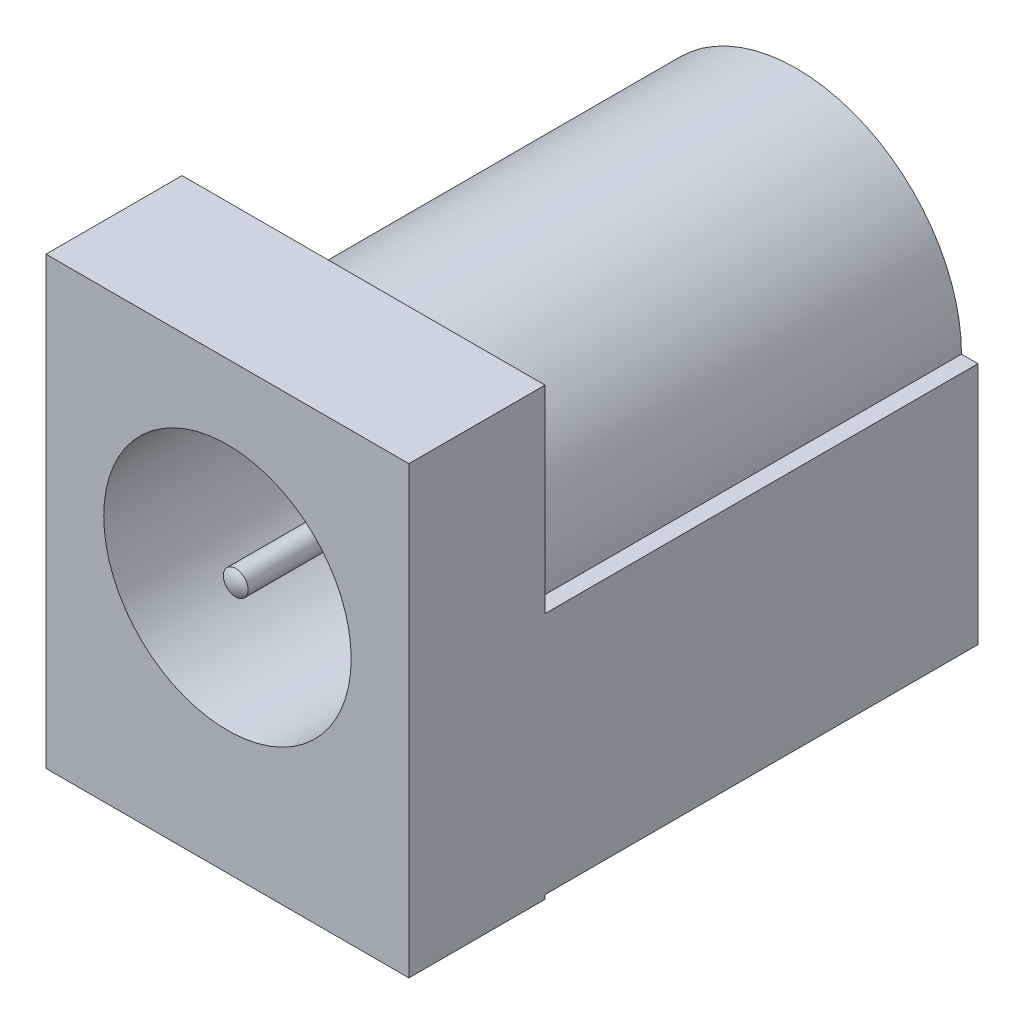
from build123d import *

# Parameters (mm, degrees)
ESQUISSE1_R             = 4
BOSS_EXTRU_1_DEPTH      = 10.5
ESQUISSE2_W             = 8.8
ESQUISSE2_H             = 10.8
BOSS_EXTRU_2_DEPTH      = 3.3
ESQUISSE3_W             = 10.5
ESQUISSE3_H             = 5.9
BOSS_EXTRU_3_DEPTH      = 8.8
ESQUISSE4_R             = 3
ENL_V_MAT_EXTRU_1_DEPTH = 12
ESQUISSE5_R             = 0.3
BOSS_EXTRU_4_DEPTH      = 11.8


# Read off the part's stored shape, not the designer's step: Dôme1
with BuildPart() as part:
    # Esquisse1 → Boss.-Extru.1 (new body)
    with BuildSketch(Plane.XY):
        with Locations(Location((0, 0, 0), (0, 0, 180))):
            Circle(ESQUISSE1_R)
    extrude(amount=BOSS_EXTRU_1_DEPTH)

    # Esquisse2 → Boss.-Extru.2 (add)
    with BuildSketch(Plane.XY.offset(10.5)):
        with Locations((0, -0.6)):
            Rectangle(ESQUISSE2_W, ESQUISSE2_H)
    extrude(amount=BOSS_EXTRU_2_DEPTH)

    # Esquisse3 → Boss.-Extru.3 (add)
    with BuildSketch(Plane(origin=(4.4, 0, 0), x_dir=(0, 0, -1), z_dir=(1, 0, 0))):
        with Locations((-5.25, -2.95)):
            Rectangle(ESQUISSE3_W, ESQUISSE3_H)
    extrude(amount=-BOSS_EXTRU_3_DEPTH)

    # Esquisse4 → Enlèv. mat.-Extru.1 (cut)
    with BuildSketch(Plane.XY.offset(13.8)):
        Circle(ESQUISSE4_R)
    extrude(amount=-ENL_V_MAT_EXTRU_1_DEPTH, mode=Mode.SUBTRACT)

    # Esquisse5 → Boss.-Extru.4 (add)
    with BuildSketch(Plane.XY.offset(1.8)):
        Circle(ESQUISSE5_R)
    extrude(amount=BOSS_EXTRU_4_DEPTH)

    # Dôme1 outline → Dôme1 (revolve)
    with BuildSketch(Plane.XZ):
        with BuildLine():
            Line((0, 13.6), (0.3, 13.6))
            ThreePointArc((0.3, 13.6), (0.158113883, 13.674341649), (0, 13.7))
            Line((0, 13.7), (0, 13.6))
        make_face()
    revolve(axis=Axis((0, 0, 0), (0, 0, 1)))


solid = part.part
